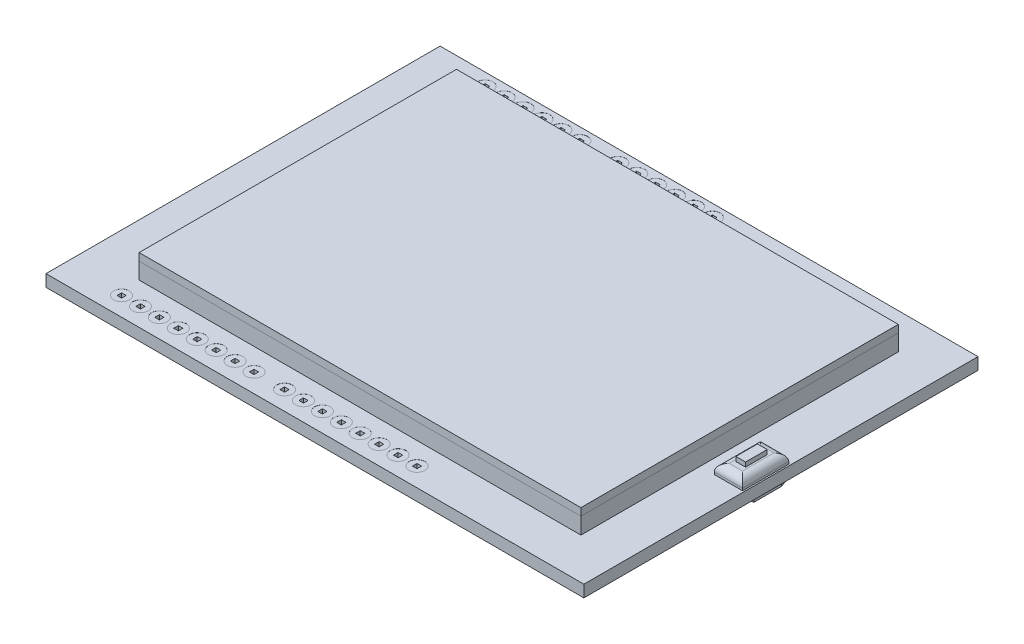
from build123d import *

# Parameters (mm, degrees)
SKETCH1_W                 = 72.2
SKETCH1_H                 = 52.9
BOSS_EXTRUDE1_DEPTH       = 1.6
SKETCH2_W                 = 59.3
SKETCH2_H                 = 42.6
BOSS_EXTRUDE2_DEPTH       = 2.2
SKETCH3_W                 = 59.3
SKETCH3_H                 = 42.6
BOSS_EXTRUDE3_DEPTH       = 1
SKETCH4_W                 = 3.8
SKETCH4_H                 = 6.2
BOSS_EXTRUDE4_DEPTH       = 1.3
FILLET1_R                 = 1
SKETCH5_W                 = 1.3
SKETCH5_H                 = 2.9
BOSS_EXTRUDE5_DEPTH       = 0.6
BOSS_EXTRUDE6_DEPTH       = 2
SKETCH7_W                 = 0.62
SKETCH7_H                 = 0.62
CUT_EXTRUDE1_DEPTH        = 1.6
SKETCH7_3_R               = 1.05
SKETCH7_3_W               = 0.62
SKETCH7_3_H               = 0.62
CUT_EXTRUDE3_DEPTH        = 0.01
SKETCH7_4_W               = 0.62
SKETCH7_4_H               = 0.62
CUT_EXTRUDE4_DEPTH        = 1.6
SKETCH7_5_R               = 1.05
SKETCH7_5_W               = 0.62
SKETCH7_5_H               = 0.62
CUT_EXTRUDE5_DEPTH        = 0.01
LPATTERN8_COUNT           = 6
LPATTERN8_PITCH           = 2.54
LPATTERN8_COPY_1_SKETCH_R = 1.05
LPATTERN8_COPY_1_SKETCH_W = 0.62
LPATTERN8_COPY_1_SKETCH_H = 0.62
LPATTERN8_COPY_1_DEPTH    = 0.01
LPATTERN8_COPY_2_SKETCH_R = 1.05
LPATTERN8_COPY_2_SKETCH_W = 0.62
LPATTERN8_COPY_2_SKETCH_H = 0.62
LPATTERN8_COPY_2_DEPTH    = 0.01
LPATTERN8_COPY_3_SKETCH_R = 1.05
LPATTERN8_COPY_3_SKETCH_W = 0.62
LPATTERN8_COPY_3_SKETCH_H = 0.62
LPATTERN8_COPY_3_DEPTH    = 0.01
LPATTERN8_COPY_4_SKETCH_R = 1.05
LPATTERN8_COPY_4_SKETCH_W = 0.62
LPATTERN8_COPY_4_SKETCH_H = 0.62
LPATTERN8_COPY_4_DEPTH    = 0.01
LPATTERN8_COPY_5_SKETCH_R = 1.05
LPATTERN8_COPY_5_SKETCH_W = 0.62
LPATTERN8_COPY_5_SKETCH_H = 0.62
LPATTERN8_COPY_5_DEPTH    = 0.01
LPATTERN9_COUNT           = 8
LPATTERN9_PITCH           = 2.54
LPATTERN9_COPY_1_SKETCH_R = 1.05
LPATTERN9_COPY_1_SKETCH_W = 0.62
LPATTERN9_COPY_1_SKETCH_H = 0.62
LPATTERN9_COPY_1_DEPTH    = 0.01
LPATTERN9_COPY_2_SKETCH_R = 1.05
LPATTERN9_COPY_2_SKETCH_W = 0.62
LPATTERN9_COPY_2_SKETCH_H = 0.62
LPATTERN9_COPY_2_DEPTH    = 0.01
LPATTERN9_COPY_3_SKETCH_R = 1.05
LPATTERN9_COPY_3_SKETCH_W = 0.62
LPATTERN9_COPY_3_SKETCH_H = 0.62
LPATTERN9_COPY_3_DEPTH    = 0.01
LPATTERN9_COPY_4_SKETCH_R = 1.05
LPATTERN9_COPY_4_SKETCH_W = 0.62
LPATTERN9_COPY_4_SKETCH_H = 0.62
LPATTERN9_COPY_4_DEPTH    = 0.01
LPATTERN9_COPY_5_SKETCH_R = 1.05
LPATTERN9_COPY_5_SKETCH_W = 0.62
LPATTERN9_COPY_5_SKETCH_H = 0.62
LPATTERN9_COPY_5_DEPTH    = 0.01
LPATTERN9_COPY_6_SKETCH_R = 1.05
LPATTERN9_COPY_6_SKETCH_W = 0.62
LPATTERN9_COPY_6_SKETCH_H = 0.62
LPATTERN9_COPY_6_DEPTH    = 0.01
LPATTERN9_COPY_7_SKETCH_R = 1.05
LPATTERN9_COPY_7_SKETCH_W = 0.62
LPATTERN9_COPY_7_SKETCH_H = 0.62
LPATTERN9_COPY_7_DEPTH    = 0.01
LPATTERN10_OUTLINE_W      = 0.62
LPATTERN10_OUTLINE_H      = 0.62
LPATTERN10_DEPTH          = 1.6
LPATTERN10_2_OUTLINE_R    = 1.05
LPATTERN10_2_OUTLINE_W    = 0.62
LPATTERN10_2_OUTLINE_H    = 0.62
LPATTERN10_2_DEPTH        = 0.01
LPATTERN10_START          = 1.59
LPATTERN10_3_OUTLINE_R    = 1.05
LPATTERN10_3_OUTLINE_W    = 0.62
LPATTERN10_3_OUTLINE_H    = 0.62
LPATTERN10_3_DEPTH        = 0.01
LPATTERN11_OUTLINE_W      = 0.62
LPATTERN11_OUTLINE_H      = 0.62
LPATTERN11_DEPTH          = 1.6
LPATTERN11_2_OUTLINE_R    = 1.05
LPATTERN11_2_OUTLINE_W    = 0.62
LPATTERN11_2_OUTLINE_H    = 0.62
LPATTERN11_2_DEPTH        = 0.01
LPATTERN11_START          = 1.59
LPATTERN11_3_OUTLINE_R    = 1.05
LPATTERN11_3_OUTLINE_W    = 0.62
LPATTERN11_3_OUTLINE_H    = 0.62
LPATTERN11_3_DEPTH        = 0.01


# Read off the part's stored shape, not the designer's step: LPattern10, LPattern11
with BuildPart() as part:
    # Sketch1 → Boss-Extrude1 (new body)
    with BuildSketch(Plane(origin=(0, 0, 0), x_dir=(1, 0, 0), z_dir=(0, 1, 0))):
        Rectangle(SKETCH1_W, SKETCH1_H)
    extrude(amount=BOSS_EXTRUDE1_DEPTH)

    # Sketch2 → Boss-Extrude2 (add)
    with BuildSketch(Plane(origin=(0, 1.6, 0), x_dir=(1, 0, 0), z_dir=(0, 1, 0))):
        with Locations((0.55, 0.35)):
            Rectangle(SKETCH2_W, SKETCH2_H)
    extrude(amount=BOSS_EXTRUDE2_DEPTH)



with BuildPart() as body_2:
    # Sketch3 → Boss-Extrude3 (new body)
    with BuildSketch(Plane(origin=(0, 3.8, 0), x_dir=(1, 0, 0), z_dir=(0, 1, 0))):
        with Locations((0.55, 0.35)):
            Rectangle(SKETCH3_W, SKETCH3_H)
    extrude(amount=BOSS_EXTRUDE3_DEPTH)


with BuildPart() as body_3:
    # Sketch4 → Boss-Extrude4 (new body)
    with BuildSketch(Plane(origin=(0, 1.6, 0), x_dir=(1, 0, 0), z_dir=(0, 1, 0))):
        with Locations((34, -1.85)):
            Rectangle(SKETCH4_W, SKETCH4_H)
    extrude(amount=BOSS_EXTRUDE4_DEPTH)

    # Fillet1
    fillet1_edges = [body_3.edges().sort_by_distance(p)[0] for p in [
        (35.9, 2.9, 1.85),
        (34, 2.9, -1.25),
        (32.1, 2.9, 1.85),
        (34, 2.9, 4.95),
    ]]
    fillet(fillet1_edges, radius=FILLET1_R)


with BuildPart() as part_1:
    add(part.part)

    add(body_3.part)  # Boss-Extrude5 merges body 3
    # Sketch5 → Boss-Extrude5 (add)
    with BuildSketch(Plane(origin=(0, 2.9, 0), x_dir=(1, 0, 0), z_dir=(0, 1, 0))):
        with Locations((34, -1.85)):
            Rectangle(SKETCH5_W, SKETCH5_H)
    extrude(amount=BOSS_EXTRUDE5_DEPTH)

    # Sketch6 → Boss-Extrude6 (add)
    with BuildSketch(Plane.XZ):
        Polygon((19.7, 1.95), (34.4, 1.95), (34.4, -1.75), (33.7, -3.75), (33.7, -13.05), (19.7, -13.05), align=None)
    extrude(amount=BOSS_EXTRUDE6_DEPTH)

    # Sketch7 → Cut-Extrude1 (cut)
    with BuildSketch(Plane(origin=(0, 1.6, 0), x_dir=(1, 0, 0), z_dir=(0, 1, 0))):
        with Locations((-28.4, 24.8)):
            Rectangle(SKETCH7_W, SKETCH7_H)
    cut_extrude1 = extrude(amount=-CUT_EXTRUDE1_DEPTH, mode=Mode.SUBTRACT)

    # Sketch7<3> → Cut-Extrude3 (cut)
    with BuildSketch(Plane(origin=(0, 1.6, 0), x_dir=(1, 0, 0), z_dir=(0, 1, 0))):
        with Locations(Location((-28.4, 24.8, 0), (0, 0, 270))):
            Circle(SKETCH7_3_R)
        with Locations((-28.4, 24.8)):
            Rectangle(SKETCH7_3_W, SKETCH7_3_H, mode=Mode.SUBTRACT)
    cut_extrude3 = extrude(amount=-CUT_EXTRUDE3_DEPTH, mode=Mode.SUBTRACT)

    # Sketch7<4> → Cut-Extrude4 (cut)
    with BuildSketch(Plane(origin=(0, 1.6, 0), x_dir=(1, 0, 0), z_dir=(0, 1, 0))):
        with Locations((-28.5, -23.91)):
            Rectangle(SKETCH7_4_W, SKETCH7_4_H)
    cut_extrude4 = extrude(amount=-CUT_EXTRUDE4_DEPTH, mode=Mode.SUBTRACT)

    # Sketch7<5> → Cut-Extrude5 (cut)
    with BuildSketch(Plane(origin=(0, 1.6, 0), x_dir=(1, 0, 0), z_dir=(0, 1, 0))):
        with Locations(Location((-28.5, -23.91, 0), (0, 0, 270))):
            Circle(SKETCH7_5_R)
        with Locations((-28.5, -23.91)):
            Rectangle(SKETCH7_5_W, SKETCH7_5_H, mode=Mode.SUBTRACT)
    cut_extrude5 = extrude(amount=-CUT_EXTRUDE5_DEPTH, mode=Mode.SUBTRACT)

    # Mirror6: Cut-Extrude3 across plane
    add(cut_extrude3.mirror(Plane.ZX.offset(0.8)), mode=Mode.SUBTRACT)

    # Mirror7: Cut-Extrude5 across plane
    add(cut_extrude5.mirror(Plane.ZX.offset(0.8)), mode=Mode.SUBTRACT)

    # LPattern8: Cut-Extrude1, Cut-Extrude3 ×6
    with Locations(*[(i * LPATTERN8_PITCH, 0, 0) for i in range(1, LPATTERN8_COUNT)]):
        add(cut_extrude1, mode=Mode.SUBTRACT)
        add(cut_extrude3, mode=Mode.SUBTRACT)

    # LPattern8 copy 1 sketch → LPattern8 copy 1 (cut)
    with BuildSketch(Plane(origin=(2.54, 0, 0), x_dir=(1, 0, 0), z_dir=(0, -1, 0))):
        with Locations((-28.4, -24.8)):
            Circle(LPATTERN8_COPY_1_SKETCH_R)
        with Locations((-28.4, -24.8)):
            Rectangle(LPATTERN8_COPY_1_SKETCH_W, LPATTERN8_COPY_1_SKETCH_H, mode=Mode.SUBTRACT)
    extrude(amount=-LPATTERN8_COPY_1_DEPTH, mode=Mode.SUBTRACT)

    # LPattern8 copy 2 sketch → LPattern8 copy 2 (cut)
    with BuildSketch(Plane(origin=(5.08, 0, 0), x_dir=(1, 0, 0), z_dir=(0, -1, 0))):
        with Locations((-28.4, -24.8)):
            Circle(LPATTERN8_COPY_2_SKETCH_R)
        with Locations((-28.4, -24.8)):
            Rectangle(LPATTERN8_COPY_2_SKETCH_W, LPATTERN8_COPY_2_SKETCH_H, mode=Mode.SUBTRACT)
    extrude(amount=-LPATTERN8_COPY_2_DEPTH, mode=Mode.SUBTRACT)

    # LPattern8 copy 3 sketch → LPattern8 copy 3 (cut)
    with BuildSketch(Plane(origin=(7.62, 0, 0), x_dir=(1, 0, 0), z_dir=(0, -1, 0))):
        with Locations((-28.4, -24.8)):
            Circle(LPATTERN8_COPY_3_SKETCH_R)
        with Locations((-28.4, -24.8)):
            Rectangle(LPATTERN8_COPY_3_SKETCH_W, LPATTERN8_COPY_3_SKETCH_H, mode=Mode.SUBTRACT)
    extrude(amount=-LPATTERN8_COPY_3_DEPTH, mode=Mode.SUBTRACT)

    # LPattern8 copy 4 sketch → LPattern8 copy 4 (cut)
    with BuildSketch(Plane(origin=(10.16, 0, 0), x_dir=(1, 0, 0), z_dir=(0, -1, 0))):
        with Locations((-28.4, -24.8)):
            Circle(LPATTERN8_COPY_4_SKETCH_R)
        with Locations((-28.4, -24.8)):
            Rectangle(LPATTERN8_COPY_4_SKETCH_W, LPATTERN8_COPY_4_SKETCH_H, mode=Mode.SUBTRACT)
    extrude(amount=-LPATTERN8_COPY_4_DEPTH, mode=Mode.SUBTRACT)

    # LPattern8 copy 5 sketch → LPattern8 copy 5 (cut)
    with BuildSketch(Plane(origin=(12.7, 0, 0), x_dir=(1, 0, 0), z_dir=(0, -1, 0))):
        with Locations((-28.4, -24.8)):
            Circle(LPATTERN8_COPY_5_SKETCH_R)
        with Locations((-28.4, -24.8)):
            Rectangle(LPATTERN8_COPY_5_SKETCH_W, LPATTERN8_COPY_5_SKETCH_H, mode=Mode.SUBTRACT)
    extrude(amount=-LPATTERN8_COPY_5_DEPTH, mode=Mode.SUBTRACT)

    # LPattern9: Cut-Extrude4, Cut-Extrude5 ×8
    with Locations(*[(i * LPATTERN9_PITCH, 0, 0) for i in range(1, LPATTERN9_COUNT)]):
        add(cut_extrude4, mode=Mode.SUBTRACT)
        add(cut_extrude5, mode=Mode.SUBTRACT)

    # LPattern9 copy 1 sketch → LPattern9 copy 1 (cut)
    with BuildSketch(Plane(origin=(2.54, 0, 0), x_dir=(1, 0, 0), z_dir=(0, -1, 0))):
        with Locations((-28.5, 23.91)):
            Circle(LPATTERN9_COPY_1_SKETCH_R)
        with Locations((-28.5, 23.91)):
            Rectangle(LPATTERN9_COPY_1_SKETCH_W, LPATTERN9_COPY_1_SKETCH_H, mode=Mode.SUBTRACT)
    extrude(amount=-LPATTERN9_COPY_1_DEPTH, mode=Mode.SUBTRACT)

    # LPattern9 copy 2 sketch → LPattern9 copy 2 (cut)
    with BuildSketch(Plane(origin=(5.08, 0, 0), x_dir=(1, 0, 0), z_dir=(0, -1, 0))):
        with Locations((-28.5, 23.91)):
            Circle(LPATTERN9_COPY_2_SKETCH_R)
        with Locations((-28.5, 23.91)):
            Rectangle(LPATTERN9_COPY_2_SKETCH_W, LPATTERN9_COPY_2_SKETCH_H, mode=Mode.SUBTRACT)
    extrude(amount=-LPATTERN9_COPY_2_DEPTH, mode=Mode.SUBTRACT)

    # LPattern9 copy 3 sketch → LPattern9 copy 3 (cut)
    with BuildSketch(Plane(origin=(7.62, 0, 0), x_dir=(1, 0, 0), z_dir=(0, -1, 0))):
        with Locations((-28.5, 23.91)):
            Circle(LPATTERN9_COPY_3_SKETCH_R)
        with Locations((-28.5, 23.91)):
            Rectangle(LPATTERN9_COPY_3_SKETCH_W, LPATTERN9_COPY_3_SKETCH_H, mode=Mode.SUBTRACT)
    extrude(amount=-LPATTERN9_COPY_3_DEPTH, mode=Mode.SUBTRACT)

    # LPattern9 copy 4 sketch → LPattern9 copy 4 (cut)
    with BuildSketch(Plane(origin=(10.16, 0, 0), x_dir=(1, 0, 0), z_dir=(0, -1, 0))):
        with Locations((-28.5, 23.91)):
            Circle(LPATTERN9_COPY_4_SKETCH_R)
        with Locations((-28.5, 23.91)):
            Rectangle(LPATTERN9_COPY_4_SKETCH_W, LPATTERN9_COPY_4_SKETCH_H, mode=Mode.SUBTRACT)
    extrude(amount=-LPATTERN9_COPY_4_DEPTH, mode=Mode.SUBTRACT)

    # LPattern9 copy 5 sketch → LPattern9 copy 5 (cut)
    with BuildSketch(Plane(origin=(12.7, 0, 0), x_dir=(1, 0, 0), z_dir=(0, -1, 0))):
        with Locations((-28.5, 23.91)):
            Circle(LPATTERN9_COPY_5_SKETCH_R)
        with Locations((-28.5, 23.91)):
            Rectangle(LPATTERN9_COPY_5_SKETCH_W, LPATTERN9_COPY_5_SKETCH_H, mode=Mode.SUBTRACT)
    extrude(amount=-LPATTERN9_COPY_5_DEPTH, mode=Mode.SUBTRACT)

    # LPattern9 copy 6 sketch → LPattern9 copy 6 (cut)
    with BuildSketch(Plane(origin=(15.24, 0, 0), x_dir=(1, 0, 0), z_dir=(0, -1, 0))):
        with Locations((-28.5, 23.91)):
            Circle(LPATTERN9_COPY_6_SKETCH_R)
        with Locations((-28.5, 23.91)):
            Rectangle(LPATTERN9_COPY_6_SKETCH_W, LPATTERN9_COPY_6_SKETCH_H, mode=Mode.SUBTRACT)
    extrude(amount=-LPATTERN9_COPY_6_DEPTH, mode=Mode.SUBTRACT)

    # LPattern9 copy 7 sketch → LPattern9 copy 7 (cut)
    with BuildSketch(Plane(origin=(17.78, 0, 0), x_dir=(1, 0, 0), z_dir=(0, -1, 0))):
        with Locations((-28.5, 23.91)):
            Circle(LPATTERN9_COPY_7_SKETCH_R)
        with Locations((-28.5, 23.91)):
            Rectangle(LPATTERN9_COPY_7_SKETCH_W, LPATTERN9_COPY_7_SKETCH_H, mode=Mode.SUBTRACT)
    extrude(amount=-LPATTERN9_COPY_7_DEPTH, mode=Mode.SUBTRACT)

    # LPattern10 outline → LPattern10 (cut)
    with BuildSketch(Plane(origin=(0, 0, 0), x_dir=(1, 0, 0), z_dir=(0, 1, 0))):
        with Locations((2.1, 24.8)):
            Rectangle(LPATTERN10_OUTLINE_W, LPATTERN10_OUTLINE_H)
        with Locations((-0.44, 24.8)):
            Rectangle(LPATTERN10_OUTLINE_W, LPATTERN10_OUTLINE_H)
        with Locations((-2.98, 24.8)):
            Rectangle(LPATTERN10_OUTLINE_W, LPATTERN10_OUTLINE_H)
        with Locations((-5.52, 24.8)):
            Rectangle(LPATTERN10_OUTLINE_W, LPATTERN10_OUTLINE_H)
        with Locations((-8.06, 24.8)):
            Rectangle(LPATTERN10_OUTLINE_W, LPATTERN10_OUTLINE_H)
        with Locations((-10.6, 24.8)):
            Rectangle(LPATTERN10_OUTLINE_W, LPATTERN10_OUTLINE_H)
    extrude(amount=LPATTERN10_DEPTH, mode=Mode.SUBTRACT)

    # LPattern10 2 outline → LPattern10 2 (cut)
    # profile 1 of 6: a face of its own
    with BuildSketch(Plane(origin=(0, 0, 0), x_dir=(1, 0, 0), z_dir=(0, 1, 0))):
        with Locations((-10.6, 24.8)):
            Circle(LPATTERN10_2_OUTLINE_R)
        with Locations((-10.6, 24.8)):
            Rectangle(LPATTERN10_2_OUTLINE_W, LPATTERN10_2_OUTLINE_H, mode=Mode.SUBTRACT)
    # profile 2 of 6: a face of its own
    with BuildSketch(Plane(origin=(0, 0, 0), x_dir=(1, 0, 0), z_dir=(0, 1, 0))):
        with Locations((-8.06, 24.8)):
            Circle(LPATTERN10_2_OUTLINE_R)
        with Locations((-8.06, 24.8)):
            Rectangle(LPATTERN10_2_OUTLINE_W, LPATTERN10_2_OUTLINE_H, mode=Mode.SUBTRACT)
    # profile 3 of 6: a face of its own
    with BuildSketch(Plane(origin=(0, 0, 0), x_dir=(1, 0, 0), z_dir=(0, 1, 0))):
        with Locations((-5.52, 24.8)):
            Circle(LPATTERN10_2_OUTLINE_R)
        with Locations((-5.52, 24.8)):
            Rectangle(LPATTERN10_2_OUTLINE_W, LPATTERN10_2_OUTLINE_H, mode=Mode.SUBTRACT)
    # profile 4 of 6: a face of its own
    with BuildSketch(Plane(origin=(0, 0, 0), x_dir=(1, 0, 0), z_dir=(0, 1, 0))):
        with Locations((-2.98, 24.8)):
            Circle(LPATTERN10_2_OUTLINE_R)
        with Locations((-2.98, 24.8)):
            Rectangle(LPATTERN10_2_OUTLINE_W, LPATTERN10_2_OUTLINE_H, mode=Mode.SUBTRACT)
    # profile 5 of 6: a face of its own
    with BuildSketch(Plane(origin=(0, 0, 0), x_dir=(1, 0, 0), z_dir=(0, 1, 0))):
        with Locations((-0.44, 24.8)):
            Circle(LPATTERN10_2_OUTLINE_R)
        with Locations((-0.44, 24.8)):
            Rectangle(LPATTERN10_2_OUTLINE_W, LPATTERN10_2_OUTLINE_H, mode=Mode.SUBTRACT)
    # profile 6 of 6: a face of its own
    with BuildSketch(Plane(origin=(0, 0, 0), x_dir=(1, 0, 0), z_dir=(0, 1, 0))):
        with Locations((2.1, 24.8)):
            Circle(LPATTERN10_2_OUTLINE_R)
        with Locations((2.1, 24.8)):
            Rectangle(LPATTERN10_2_OUTLINE_W, LPATTERN10_2_OUTLINE_H, mode=Mode.SUBTRACT)
    extrude(amount=LPATTERN10_2_DEPTH, mode=Mode.SUBTRACT)

    # LPattern10 3 outline → LPattern10 3 (cut)
    # profile 1 of 6: a face of its own
    with BuildSketch(Plane(origin=(0, 0, 0), x_dir=(1, 0, 0), z_dir=(0, 1, 0)).offset(LPATTERN10_START)):
        with Locations((-10.6, 24.8)):
            Circle(LPATTERN10_3_OUTLINE_R)
        with Locations((-10.6, 24.8)):
            Rectangle(LPATTERN10_3_OUTLINE_W, LPATTERN10_3_OUTLINE_H, mode=Mode.SUBTRACT)
    # profile 2 of 6: a face of its own
    with BuildSketch(Plane(origin=(0, 0, 0), x_dir=(1, 0, 0), z_dir=(0, 1, 0)).offset(LPATTERN10_START)):
        with Locations((-8.06, 24.8)):
            Circle(LPATTERN10_3_OUTLINE_R)
        with Locations((-8.06, 24.8)):
            Rectangle(LPATTERN10_3_OUTLINE_W, LPATTERN10_3_OUTLINE_H, mode=Mode.SUBTRACT)
    # profile 3 of 6: a face of its own
    with BuildSketch(Plane(origin=(0, 0, 0), x_dir=(1, 0, 0), z_dir=(0, 1, 0)).offset(LPATTERN10_START)):
        with Locations((-5.52, 24.8)):
            Circle(LPATTERN10_3_OUTLINE_R)
        with Locations((-5.52, 24.8)):
            Rectangle(LPATTERN10_3_OUTLINE_W, LPATTERN10_3_OUTLINE_H, mode=Mode.SUBTRACT)
    # profile 4 of 6: a face of its own
    with BuildSketch(Plane(origin=(0, 0, 0), x_dir=(1, 0, 0), z_dir=(0, 1, 0)).offset(LPATTERN10_START)):
        with Locations((-2.98, 24.8)):
            Circle(LPATTERN10_3_OUTLINE_R)
        with Locations((-2.98, 24.8)):
            Rectangle(LPATTERN10_3_OUTLINE_W, LPATTERN10_3_OUTLINE_H, mode=Mode.SUBTRACT)
    # profile 5 of 6: a face of its own
    with BuildSketch(Plane(origin=(0, 0, 0), x_dir=(1, 0, 0), z_dir=(0, 1, 0)).offset(LPATTERN10_START)):
        with Locations((-0.44, 24.8)):
            Circle(LPATTERN10_3_OUTLINE_R)
        with Locations((-0.44, 24.8)):
            Rectangle(LPATTERN10_3_OUTLINE_W, LPATTERN10_3_OUTLINE_H, mode=Mode.SUBTRACT)
    # profile 6 of 6: a face of its own
    with BuildSketch(Plane(origin=(0, 0, 0), x_dir=(1, 0, 0), z_dir=(0, 1, 0)).offset(LPATTERN10_START)):
        with Locations((2.1, 24.8)):
            Circle(LPATTERN10_3_OUTLINE_R)
        with Locations((2.1, 24.8)):
            Rectangle(LPATTERN10_3_OUTLINE_W, LPATTERN10_3_OUTLINE_H, mode=Mode.SUBTRACT)
    extrude(amount=LPATTERN10_3_DEPTH, mode=Mode.SUBTRACT)

    # LPattern11 outline → LPattern11 (cut)
    with BuildSketch(Plane(origin=(0, 0, 0), x_dir=(1, 0, 0), z_dir=(0, 1, 0))):
        with Locations((11.16, -23.91)):
            Rectangle(LPATTERN11_OUTLINE_W, LPATTERN11_OUTLINE_H)
        with Locations((8.62, -23.91)):
            Rectangle(LPATTERN11_OUTLINE_W, LPATTERN11_OUTLINE_H)
        with Locations((6.08, -23.91)):
            Rectangle(LPATTERN11_OUTLINE_W, LPATTERN11_OUTLINE_H)
        with Locations((3.54, -23.91)):
            Rectangle(LPATTERN11_OUTLINE_W, LPATTERN11_OUTLINE_H)
        with Locations((1, -23.91)):
            Rectangle(LPATTERN11_OUTLINE_W, LPATTERN11_OUTLINE_H)
        with Locations((-1.54, -23.91)):
            Rectangle(LPATTERN11_OUTLINE_W, LPATTERN11_OUTLINE_H)
        with Locations((-4.08, -23.91)):
            Rectangle(LPATTERN11_OUTLINE_W, LPATTERN11_OUTLINE_H)
        with Locations((-6.62, -23.91)):
            Rectangle(LPATTERN11_OUTLINE_W, LPATTERN11_OUTLINE_H)
    extrude(amount=LPATTERN11_DEPTH, mode=Mode.SUBTRACT)

    # LPattern11 2 outline → LPattern11 2 (cut)
    # profile 1 of 8: a face of its own
    with BuildSketch(Plane(origin=(0, 0, 0), x_dir=(1, 0, 0), z_dir=(0, 1, 0))):
        with Locations((-6.62, -23.91)):
            Circle(LPATTERN11_2_OUTLINE_R)
        with Locations((-6.62, -23.91)):
            Rectangle(LPATTERN11_2_OUTLINE_W, LPATTERN11_2_OUTLINE_H, mode=Mode.SUBTRACT)
    # profile 2 of 8: a face of its own
    with BuildSketch(Plane(origin=(0, 0, 0), x_dir=(1, 0, 0), z_dir=(0, 1, 0))):
        with Locations((-4.08, -23.91)):
            Circle(LPATTERN11_2_OUTLINE_R)
        with Locations((-4.08, -23.91)):
            Rectangle(LPATTERN11_2_OUTLINE_W, LPATTERN11_2_OUTLINE_H, mode=Mode.SUBTRACT)
    # profile 3 of 8: a face of its own
    with BuildSketch(Plane(origin=(0, 0, 0), x_dir=(1, 0, 0), z_dir=(0, 1, 0))):
        with Locations((-1.54, -23.91)):
            Circle(LPATTERN11_2_OUTLINE_R)
        with Locations((-1.54, -23.91)):
            Rectangle(LPATTERN11_2_OUTLINE_W, LPATTERN11_2_OUTLINE_H, mode=Mode.SUBTRACT)
    # profile 4 of 8: a face of its own
    with BuildSketch(Plane(origin=(0, 0, 0), x_dir=(1, 0, 0), z_dir=(0, 1, 0))):
        with Locations((1, -23.91)):
            Circle(LPATTERN11_2_OUTLINE_R)
        with Locations((1, -23.91)):
            Rectangle(LPATTERN11_2_OUTLINE_W, LPATTERN11_2_OUTLINE_H, mode=Mode.SUBTRACT)
    # profile 5 of 8: a face of its own
    with BuildSketch(Plane(origin=(0, 0, 0), x_dir=(1, 0, 0), z_dir=(0, 1, 0))):
        with Locations((3.54, -23.91)):
            Circle(LPATTERN11_2_OUTLINE_R)
        with Locations((3.54, -23.91)):
            Rectangle(LPATTERN11_2_OUTLINE_W, LPATTERN11_2_OUTLINE_H, mode=Mode.SUBTRACT)
    # profile 6 of 8: a face of its own
    with BuildSketch(Plane(origin=(0, 0, 0), x_dir=(1, 0, 0), z_dir=(0, 1, 0))):
        with Locations((6.08, -23.91)):
            Circle(LPATTERN11_2_OUTLINE_R)
        with Locations((6.08, -23.91)):
            Rectangle(LPATTERN11_2_OUTLINE_W, LPATTERN11_2_OUTLINE_H, mode=Mode.SUBTRACT)
    # profile 7 of 8: a face of its own
    with BuildSketch(Plane(origin=(0, 0, 0), x_dir=(1, 0, 0), z_dir=(0, 1, 0))):
        with Locations((8.62, -23.91)):
            Circle(LPATTERN11_2_OUTLINE_R)
        with Locations((8.62, -23.91)):
            Rectangle(LPATTERN11_2_OUTLINE_W, LPATTERN11_2_OUTLINE_H, mode=Mode.SUBTRACT)
    # profile 8 of 8: a face of its own
    with BuildSketch(Plane(origin=(0, 0, 0), x_dir=(1, 0, 0), z_dir=(0, 1, 0))):
        with Locations((11.16, -23.91)):
            Circle(LPATTERN11_2_OUTLINE_R)
        with Locations((11.16, -23.91)):
            Rectangle(LPATTERN11_2_OUTLINE_W, LPATTERN11_2_OUTLINE_H, mode=Mode.SUBTRACT)
    extrude(amount=LPATTERN11_2_DEPTH, mode=Mode.SUBTRACT)

    # LPattern11 3 outline → LPattern11 3 (cut)
    # profile 1 of 8: a face of its own
    with BuildSketch(Plane(origin=(0, 0, 0), x_dir=(1, 0, 0), z_dir=(0, 1, 0)).offset(LPATTERN11_START)):
        with Locations((-6.62, -23.91)):
            Circle(LPATTERN11_3_OUTLINE_R)
        with Locations((-6.62, -23.91)):
            Rectangle(LPATTERN11_3_OUTLINE_W, LPATTERN11_3_OUTLINE_H, mode=Mode.SUBTRACT)
    # profile 2 of 8: a face of its own
    with BuildSketch(Plane(origin=(0, 0, 0), x_dir=(1, 0, 0), z_dir=(0, 1, 0)).offset(LPATTERN11_START)):
        with Locations((-4.08, -23.91)):
            Circle(LPATTERN11_3_OUTLINE_R)
        with Locations((-4.08, -23.91)):
            Rectangle(LPATTERN11_3_OUTLINE_W, LPATTERN11_3_OUTLINE_H, mode=Mode.SUBTRACT)
    # profile 3 of 8: a face of its own
    with BuildSketch(Plane(origin=(0, 0, 0), x_dir=(1, 0, 0), z_dir=(0, 1, 0)).offset(LPATTERN11_START)):
        with Locations((-1.54, -23.91)):
            Circle(LPATTERN11_3_OUTLINE_R)
        with Locations((-1.54, -23.91)):
            Rectangle(LPATTERN11_3_OUTLINE_W, LPATTERN11_3_OUTLINE_H, mode=Mode.SUBTRACT)
    # profile 4 of 8: a face of its own
    with BuildSketch(Plane(origin=(0, 0, 0), x_dir=(1, 0, 0), z_dir=(0, 1, 0)).offset(LPATTERN11_START)):
        with Locations((1, -23.91)):
            Circle(LPATTERN11_3_OUTLINE_R)
        with Locations((1, -23.91)):
            Rectangle(LPATTERN11_3_OUTLINE_W, LPATTERN11_3_OUTLINE_H, mode=Mode.SUBTRACT)
    # profile 5 of 8: a face of its own
    with BuildSketch(Plane(origin=(0, 0, 0), x_dir=(1, 0, 0), z_dir=(0, 1, 0)).offset(LPATTERN11_START)):
        with Locations((3.54, -23.91)):
            Circle(LPATTERN11_3_OUTLINE_R)
        with Locations((3.54, -23.91)):
            Rectangle(LPATTERN11_3_OUTLINE_W, LPATTERN11_3_OUTLINE_H, mode=Mode.SUBTRACT)
    # profile 6 of 8: a face of its own
    with BuildSketch(Plane(origin=(0, 0, 0), x_dir=(1, 0, 0), z_dir=(0, 1, 0)).offset(LPATTERN11_START)):
        with Locations((6.08, -23.91)):
            Circle(LPATTERN11_3_OUTLINE_R)
        with Locations((6.08, -23.91)):
            Rectangle(LPATTERN11_3_OUTLINE_W, LPATTERN11_3_OUTLINE_H, mode=Mode.SUBTRACT)
    # profile 7 of 8: a face of its own
    with BuildSketch(Plane(origin=(0, 0, 0), x_dir=(1, 0, 0), z_dir=(0, 1, 0)).offset(LPATTERN11_START)):
        with Locations((8.62, -23.91)):
            Circle(LPATTERN11_3_OUTLINE_R)
        with Locations((8.62, -23.91)):
            Rectangle(LPATTERN11_3_OUTLINE_W, LPATTERN11_3_OUTLINE_H, mode=Mode.SUBTRACT)
    # profile 8 of 8: a face of its own
    with BuildSketch(Plane(origin=(0, 0, 0), x_dir=(1, 0, 0), z_dir=(0, 1, 0)).offset(LPATTERN11_START)):
        with Locations((11.16, -23.91)):
            Circle(LPATTERN11_3_OUTLINE_R)
        with Locations((11.16, -23.91)):
            Rectangle(LPATTERN11_3_OUTLINE_W, LPATTERN11_3_OUTLINE_H, mode=Mode.SUBTRACT)
    extrude(amount=LPATTERN11_3_DEPTH, mode=Mode.SUBTRACT)


solid = Compound([body_2.part, part_1.part])
